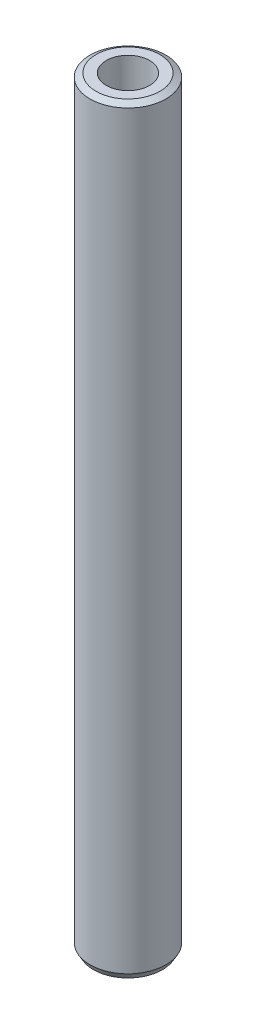
from build123d import *
from OCP.BRepFilletAPI import BRepFilletAPI_MakeChamfer

# Parameters (mm, degrees)
SKETCH1_R           = 20
BOSS_EXTRUDE1_DEPTH = 399.763591333
SKETCH2_R           = 11.413769517
CUT_EXTRUDE1_DEPTH  = 401.762933609
CHAMFER1_SIZE       = 1.850419066
CHAMFER1_SIZE2      = 3.205019837


with BuildPart() as part:
    # Sketch1 → Boss-Extrude1 (new body)
    with BuildSketch(Plane(origin=(0, 0, 0), x_dir=(1, 0, 0), z_dir=(0, 1, 0))):
        Circle(SKETCH1_R)
    extrude(amount=BOSS_EXTRUDE1_DEPTH)

    # Sketch2 → Cut-Extrude1 (cut, through all)
    with BuildSketch(Plane(origin=(0, 0, 0), x_dir=(1, 0, 0), z_dir=(0, 1, 0))):
        Circle(SKETCH2_R)
    extrude(amount=CUT_EXTRUDE1_DEPTH, mode=Mode.SUBTRACT)

    # Chamfer1: one chamfer whose edges measure the first distance from different faces: ONE call of the kernel's chamfer builder (chamfer() names one face for all edges)
    chamfer1_edges_1 = [part.edges().sort_by_distance(p)[0] for p in [
        (-20, 399.763591333, 0),
    ]]
    chamfer1_side_1 = [part.faces().sort_by_distance(p)[0] for p in [
        (-20, 199.881795666, 0),
    ]]
    chamfer1_edges_2 = [part.edges().sort_by_distance(p)[0] for p in [
        (-20, 0, 0),
    ]]
    chamfer1_side_2 = [part.faces().sort_by_distance(p)[0] for p in [
        (-19.434314575, 0, 0),
    ]]
    chamfer1 = BRepFilletAPI_MakeChamfer(part.part.solid().wrapped)
    for e in chamfer1_edges_1:
        chamfer1.Add(CHAMFER1_SIZE, CHAMFER1_SIZE2, e.wrapped, chamfer1_side_1[0].wrapped)  # the first distance lies on this face
    for e in chamfer1_edges_2:
        chamfer1.Add(CHAMFER1_SIZE, CHAMFER1_SIZE2, e.wrapped, chamfer1_side_2[0].wrapped)  # the first distance lies on this face
    add(Compound.cast(chamfer1.Shape()), mode=Mode.REPLACE)


solid = part.part
